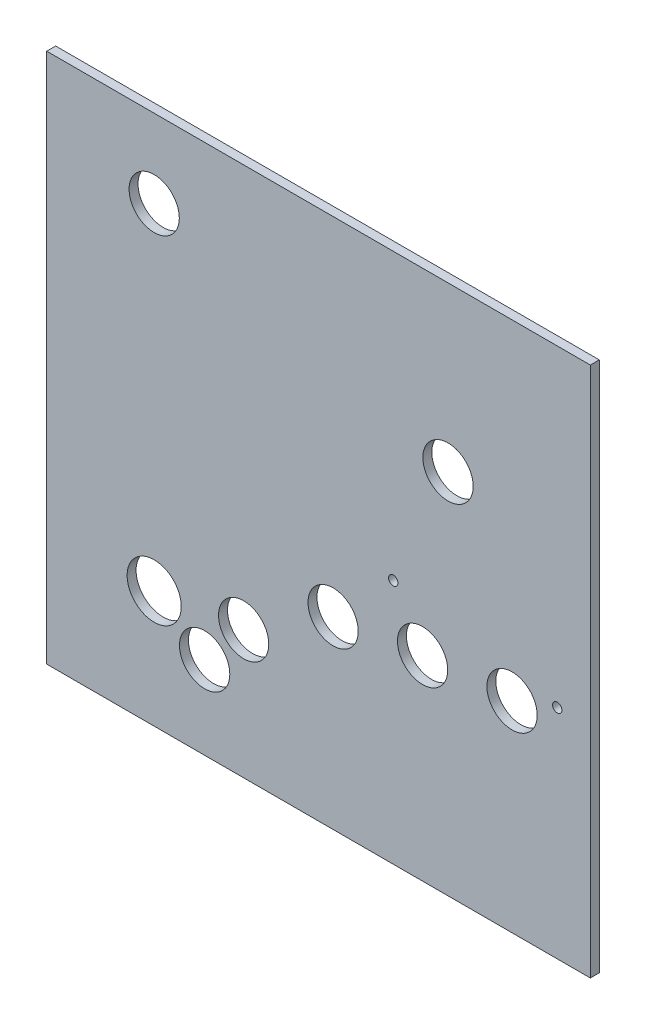
from build123d import *

# Parameters (mm, degrees)
SKETCH1_W           = 308.670974492
SKETCH1_H           = 301.431446828
SKETCH1_R           = 15.365901376
SKETCH1_R_2         = 14.2875
SKETCH1_R_3         = 14.2621
SKETCH1_R_4         = 2.667
BOSS_EXTRUDE1_DEPTH = 5.08


with BuildPart() as part:
    # Sketch1 → Boss-Extrude1 (new body)
    with BuildSketch(Plane.XY):
        with Locations((-73.533038571, -57.730082993)):
            Rectangle(SKETCH1_W, SKETCH1_H)
        with Locations((-166.847551324, -141.964359579)):
            Circle(SKETCH1_R, mode=Mode.SUBTRACT)
        with Locations((-138.201859455, -161.438962032)):
            Circle(SKETCH1_R_2, mode=Mode.SUBTRACT)
        with Locations((-116.047551324, -135.614359579)):
            Circle(SKETCH1_R_3, mode=Mode.SUBTRACT)
        with Locations((-65.247551325, -103.864359579)):
            Circle(SKETCH1_R_3, mode=Mode.SUBTRACT)
        with Locations((-14.447551325, -97.514359579)):
            Circle(SKETCH1_R_3, mode=Mode.SUBTRACT)
        with Locations((-31.097382624, -68.885457791)):
            Circle(SKETCH1_R_4, mode=Mode.SUBTRACT)
        with Locations((36.352448675, -94.389320601)):
            Circle(SKETCH1_R_2, mode=Mode.SUBTRACT)
        with Locations((61.997437845, -84.856139017)):
            Circle(SKETCH1_R_4, mode=Mode.SUBTRACT)
        with Locations((-166.847551324, 48.535640421)):
            Circle(SKETCH1_R_3, mode=Mode.SUBTRACT)
        Circle(SKETCH1_R_2, mode=Mode.SUBTRACT)
    extrude(amount=BOSS_EXTRUDE1_DEPTH)


solid = part.part
